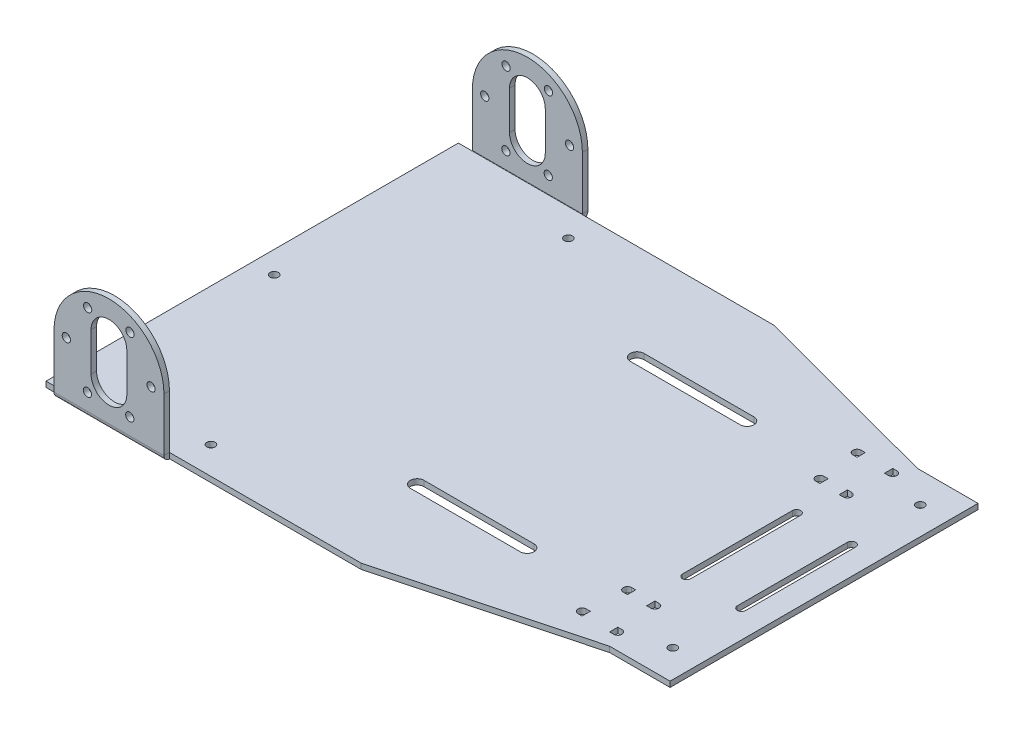
from build123d import *

# Parameters (mm, degrees)
BRIDA_BASE1_DEPTH           = 2
CROQUIS5_R                  = 1.5
CORTAR_EXTRUIR1_DEPTH       = 10
PLIEGUE_START               = -123.687
PLIEGUE_CROQUIZADO1_DEPTH   = 40
PLIEGUE_CROQUIZADO1_2_DEPTH = 40
CROQUIS7_R                  = 1.5
CORTAR_EXTRUIR2_DEPTH       = 206.264173359


# Read off the part's stored shape, not the designer's step: Pliegue croquizado1
# Sheet-metal steps are written as plain solids
with BuildPart() as part:
    # Croquis base → Brida base1 (new body)
    with BuildSketch(Plane(origin=(0, 0, 0), x_dir=(1, 0, 0), z_dir=(0, 1, 0))):
        Polygon((-14.061, -75), (-83.687, -75), (-83.687, -119), (-123.687, -119), (-123.687, -75), (-128.687, -75), (-128.687, 75), (-123.687, 75), (-123.687, 119), (-83.687, 119), (-83.687, 75), (-14.061, 75), (57.313, 56), (79.313, 56), (79.313, -56), (57.313, -56), align=None)
    extrude(amount=-BRIDA_BASE1_DEPTH)

    # Croquis5 → Cortar-Extruir1 (cut)
    with BuildSketch(Plane(origin=(0, 0, 0), x_dir=(1, 0, 0), z_dir=(0, 1, 0))):
        with Locations(Location((-78.687, -65, 0), (0, 0, 270))):
            Circle(CROQUIS5_R)
        with Locations(Location((69.313, -45, 0), (0, 0, 270))):
            Circle(CROQUIS5_R)
        with Locations(Location((69.313, 45, 0), (0, 0, 90))):
            Circle(CROQUIS5_R)
        with Locations(Location((-78.687, 65, 0), (0, 0, 90))):
            Circle(CROQUIS5_R)
        with Locations(Location((-120.687, 0, 0), (0, 0, 270))):
            Circle(CROQUIS5_R)
        with BuildLine():
            Line((-28.687, -37.5), (11.313, -37.5))
            ThreePointArc((11.313, -37.5), (13.813, -40), (11.313, -42.5))
            Line((11.313, -42.5), (-28.687, -42.5))
            ThreePointArc((-28.687, -42.5), (-31.187, -40), (-28.687, -37.5))
        make_face()
        with BuildLine():
            Line((41.313, -51.5), (42.813, -51.5))
            Line((42.813, -51.5), (42.813, -48.5))
            Line((42.813, -48.5), (41.313, -48.5))
            ThreePointArc((41.313, -48.5), (39.813, -50), (41.313, -51.5))
        make_face()
        with BuildLine():
            Line((51.313, 36.5), (52.813, 36.5))
            ThreePointArc((52.813, 36.5), (54.313, 35), (52.813, 33.5))
            Line((52.813, 33.5), (51.313, 33.5))
            Line((51.313, 33.5), (51.313, 36.5))
        make_face()
        with BuildLine():
            Line((52.813, -48.5), (54.313, -48.5))
            ThreePointArc((54.313, -48.5), (55.813, -50), (54.313, -51.5))
            Line((54.313, -51.5), (52.813, -51.5))
            Line((52.813, -51.5), (52.813, -48.5))
        make_face()
        with BuildLine():
            Line((42.813, -33.5), (44.313, -33.5))
            Line((44.313, -33.5), (44.313, -36.5))
            Line((44.313, -36.5), (42.813, -36.5))
            ThreePointArc((42.813, -36.5), (41.313, -35), (42.813, -33.5))
        make_face()
        with BuildLine():
            Line((51.313, -33.5), (52.813, -33.5))
            ThreePointArc((52.813, -33.5), (54.313, -35), (52.813, -36.5))
            Line((52.813, -36.5), (51.313, -36.5))
            Line((51.313, -36.5), (51.313, -33.5))
        make_face()
        with BuildLine():
            Line((44.313, 33.5), (44.313, 36.5))
            Line((44.313, 36.5), (42.813, 36.5))
            ThreePointArc((42.813, 36.5), (41.313, 35), (42.813, 33.5))
            Line((42.813, 33.5), (44.313, 33.5))
        make_face()
        with BuildLine():
            Line((52.813, 51.5), (54.313, 51.5))
            ThreePointArc((54.313, 51.5), (55.813, 50), (54.313, 48.5))
            Line((54.313, 48.5), (52.813, 48.5))
            Line((52.813, 48.5), (52.813, 51.5))
        make_face()
        with BuildLine():
            Line((42.813, 51.5), (42.813, 48.5))
            Line((42.813, 48.5), (41.313, 48.5))
            ThreePointArc((41.313, 48.5), (39.813, 50), (41.313, 51.5))
            Line((41.313, 51.5), (42.813, 51.5))
        make_face()
        with BuildLine():
            Line((-28.687, 37.5), (11.313, 37.5))
            ThreePointArc((11.313, 37.5), (13.813, 40), (11.313, 42.5))
            Line((11.313, 42.5), (-28.687, 42.5))
            ThreePointArc((-28.687, 42.5), (-31.187, 40), (-28.687, 37.5))
        make_face()
        with BuildLine():
            Line((47.813, 20), (47.813, -20))
            ThreePointArc((47.813, -20), (49.313, -21.5), (50.813, -20))
            Line((50.813, -20), (50.813, 20))
            ThreePointArc((50.813, 20), (49.313, 21.5), (47.813, 20))
        make_face()
        with BuildLine():
            Line((67.813, 20), (67.813, -20))
            ThreePointArc((67.813, -20), (69.313, -21.5), (70.813, -20))
            Line((70.813, -20), (70.813, 20))
            ThreePointArc((70.813, 20), (69.313, 21.5), (67.813, 20))
        make_face()
    extrude(amount=-CORTAR_EXTRUIR1_DEPTH, mode=Mode.SUBTRACT)

    # Pliegue croquizado1 outline → Pliegue croquizado1 (cut)
    with BuildSketch(Plane.YZ.offset(PLIEGUE_START)):
        with BuildLine():
            ThreePointArc((0, -77.097617696), (-1.419868415, -76.449137674), (-2, -75))
            Line((-2, -75), (-2, -119))
            Line((-2, -119), (0, -119))
            Line((0, -119), (0, -77.097617696))
        make_face()
        with BuildLine():
            Line((-2, 119), (-2, 75))
            ThreePointArc((-2, 75), (-1.419868415, 76.449137674), (0, 77.097617696))
            Line((0, 77.097617696), (0, 119))
            Line((0, 119), (-2, 119))
        make_face()
    extrude(amount=PLIEGUE_CROQUIZADO1_DEPTH, mode=Mode.SUBTRACT)

    # Pliegue croquizado1 2 outline → Pliegue croquizado1 2 (add)
    with BuildSketch(Plane.YZ.offset(PLIEGUE_START)):
        with BuildLine():
            Line((0, -75), (0, -77.097617696))
            ThreePointArc((0, -77.097617696), (0.049985814, -77.09940434), (0.1, -77.1))
            Line((0.1, -77.1), (42.372124041, -77.1))
            Line((42.372124041, -77.1), (42.372124041, -75.1))
            Line((42.372124041, -75.1), (0.1, -75.1))
            ThreePointArc((0.1, -75.1), (0.029289322, -75.070710678), (0, -75))
        make_face()
        with BuildLine():
            ThreePointArc((0.1, 77.1), (0.049985814, 77.09940434), (0, 77.097617696))
            Line((0, 77.097617696), (0, 75))
            ThreePointArc((0, 75), (0.029289322, 75.070710678), (0.1, 75.1))
            Line((0.1, 75.1), (42.372124041, 75.1))
            Line((42.372124041, 75.1), (42.372124041, 77.1))
            Line((42.372124041, 77.1), (0.1, 77.1))
        make_face()
    extrude(amount=PLIEGUE_CROQUIZADO1_2_DEPTH)

    # Croquis7 → Cortar-Extruir2 (cut, through all)
    with BuildSketch(Plane.XY.offset(77.1)):
        with BuildLine():
            Line((-103.687, 39.5), (-103.687, 42.372124041))
            Line((-103.687, 42.372124041), (-123.687, 42.372124041))
            Line((-123.687, 42.372124041), (-123.687, 19.5))
            ThreePointArc((-123.687, 19.5), (-117.829135624, 33.642135624), (-103.687, 39.5))
        make_face()
        with BuildLine():
            Line((-83.687, 42.372124041), (-103.687, 42.372124041))
            Line((-103.687, 42.372124041), (-103.687, 39.5))
            ThreePointArc((-103.687, 39.5), (-89.544864376, 33.642135624), (-83.687, 19.5))
            Line((-83.687, 19.5), (-83.687, 42.372124041))
        make_face()
        with BuildLine():
            Line((-110.187, 26.5), (-110.187, 12.5))
            ThreePointArc((-110.187, 12.5), (-103.687, 6), (-97.187, 12.5))
            Line((-97.187, 12.5), (-97.187, 26.5))
            ThreePointArc((-97.187, 26.5), (-103.687, 33), (-110.187, 26.5))
        make_face()
        with Locations((-119.187, 19.5)):
            Circle(CROQUIS7_R)
        with Locations((-111.437, 32.823393759)):
            Circle(CROQUIS7_R)
        with Locations((-96.02360254, 32.773393759)):
            Circle(CROQUIS7_R)
        with Locations((-88.360205081, 19.4)):
            Circle(CROQUIS7_R)
        with Locations((-96.110205081, 6.076606241)):
            Circle(CROQUIS7_R)
        with Locations((-111.52360254, 6.126606241)):
            Circle(CROQUIS7_R)
    extrude(amount=-CORTAR_EXTRUIR2_DEPTH, mode=Mode.SUBTRACT)


solid = part.part
